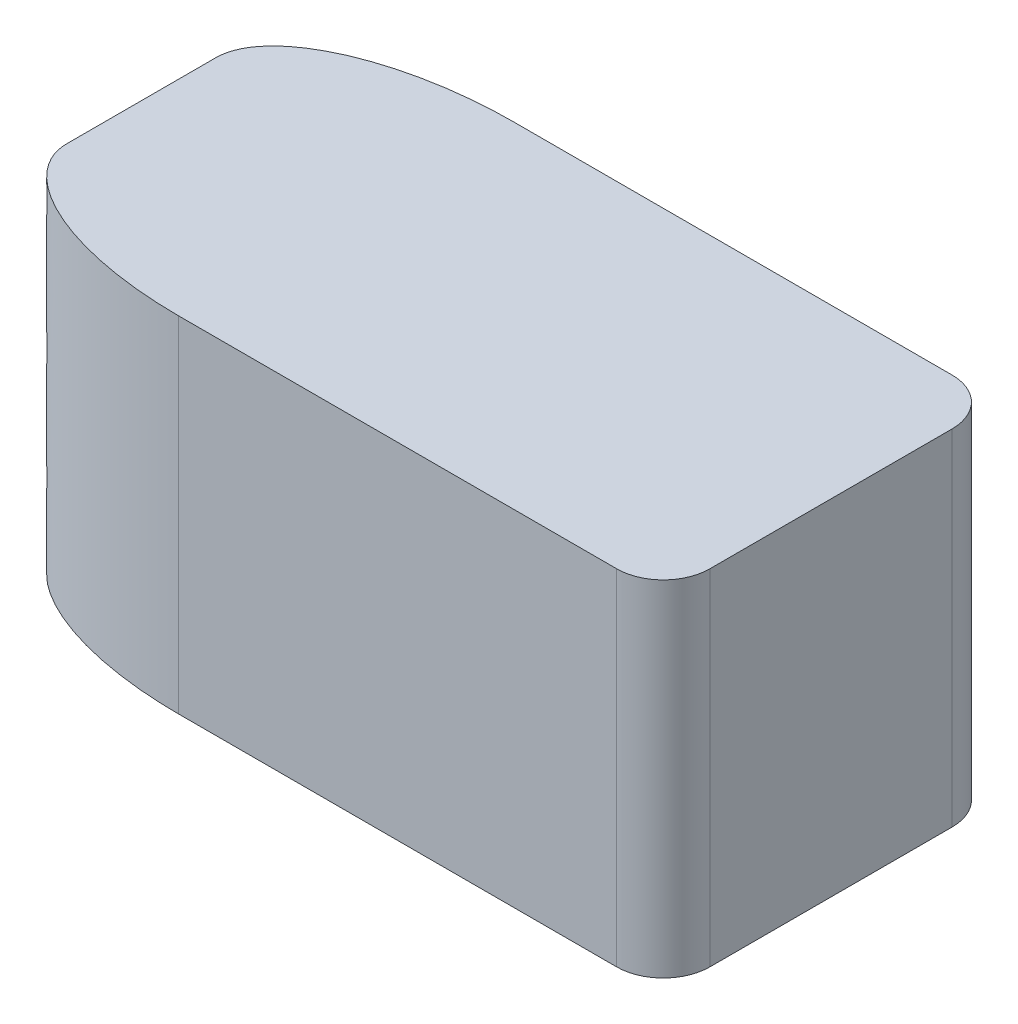
from build123d import *

# Parameters (mm, degrees)
SKETCH1_W           = 74
SKETCH1_H           = 36
BOSS_EXTRUDE1_DEPTH = 18.5
FILLET1_SIZE        = 22
FILLET1_SIZE_2      = 10
FILLET2_R           = 5


with BuildPart() as part:
    # Sketch1 → Boss-Extrude1 (new, symmetric)
    with BuildSketch(Plane(origin=(0, 0, 0), x_dir=(1, 0, 0), z_dir=(0, 1, 0))):
        Rectangle(SKETCH1_W, SKETCH1_H)
    extrude(amount=BOSS_EXTRUDE1_DEPTH, both=True)

    # Fillet1
    # an asymmetric fillet: 22, 10 mm, written as the material it takes off along each edge
    with BuildSketch(Plane(origin=(-37, 73.5, -18), x_dir=(1, 0, 0), z_dir=(0, -1, 0))) as fillet1_piece_1:
        with BuildLine():
            Bezier((FILLET1_SIZE, 0), (0, 0), (0, FILLET1_SIZE_2), weights=[1, 0.707106781, 1])
            Line((0, FILLET1_SIZE_2), (0, 0))
            Line((0, 0), (FILLET1_SIZE, 0))
        make_face()
    extrude(amount=147, mode=Mode.SUBTRACT)
    with BuildSketch(Plane(origin=(-37, 73.5, 18), x_dir=(1, 0, 0), z_dir=(0, -1, 0))) as fillet1_piece_2:
        with BuildLine():
            Bezier((FILLET1_SIZE, 0), (0, 0), (0, -FILLET1_SIZE_2), weights=[1, 0.707106781, 1])
            Line((0, -FILLET1_SIZE_2), (0, 0))
            Line((0, 0), (FILLET1_SIZE, 0))
        make_face()
    extrude(amount=147, mode=Mode.SUBTRACT)

    # Fillet2
    fillet2_edges = [part.edges().sort_by_distance(p)[0] for p in [
        (37, 0, -18),
        (37, 0, 18),
    ]]
    fillet(fillet2_edges, radius=FILLET2_R)


solid = part.part
